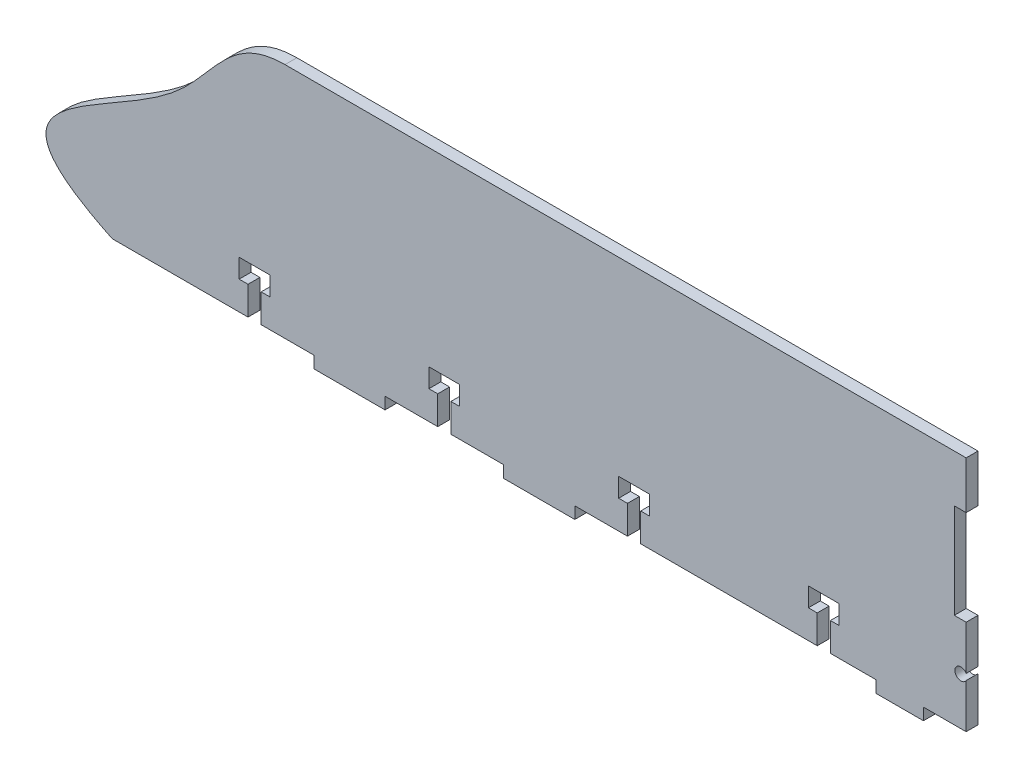
from build123d import *

# Parameters (mm, degrees)
BOSS_EXTRUDE1_DEPTH = 3.175


with BuildPart() as part:
    # Sketch1 → Boss-Extrude1 (new body)
    with BuildSketch(Plane.XY):
        with BuildLine():
            Line((-68.050090825, 31.75), (111.125, 31.75))
            Line((111.125, 31.75), (114.3, 31.75))
            Line((114.3, 31.75), (114.3, 19.05))
            Line((114.3, 19.05), (111.125, 19.05))
            Line((111.125, 19.05), (111.125, -6.35))
            Line((111.125, -6.35), (114.3, -6.35))
            Line((114.3, -6.35), (114.3, -18.229405084))
            ThreePointArc((114.3, -18.229405084), (111.271118366, -19.05), (114.3, -19.870594916))
            Line((114.3, -19.870594916), (114.3, -31.75))
            Line((114.3, -31.75), (111.125, -31.75))
            Line((111.125, -31.75), (102.87, -31.75))
            Line((102.87, -31.75), (102.87, -34.925))
            Line((102.87, -34.925), (90.17, -34.925))
            Line((90.17, -34.925), (90.17, -31.75))
            Line((90.17, -31.75), (88.19515, -31.75))
            Line((88.19515, -31.75), (77.9653, -31.75))
            Line((77.9653, -31.75), (77.9653, -24.13))
            Line((77.9653, -24.13), (80.3275, -24.13))
            Line((80.3275, -24.13), (80.3275, -19.05))
            Line((80.3275, -19.05), (72.0725, -19.05))
            Line((72.0725, -19.05), (72.0725, -24.13))
            Line((72.0725, -24.13), (74.4347, -24.13))
            Line((74.4347, -24.13), (74.4347, -31.75))
            Line((74.4347, -31.75), (27.1653, -31.75))
            Line((27.1653, -31.75), (27.1653, -24.13))
            Line((27.1653, -24.13), (29.5275, -24.13))
            Line((29.5275, -24.13), (29.5275, -19.05))
            Line((29.5275, -19.05), (21.2725, -19.05))
            Line((21.2725, -19.05), (21.2725, -24.13))
            Line((21.2725, -24.13), (23.6347, -24.13))
            Line((23.6347, -24.13), (23.6347, -31.75))
            Line((23.6347, -31.75), (9.525, -31.75))
            Line((9.525, -31.75), (9.525, -34.925))
            Line((9.525, -34.925), (-9.525, -34.925))
            Line((-9.525, -34.925), (-9.525, -31.75))
            Line((-9.525, -31.75), (-23.6347, -31.75))
            Line((-23.6347, -31.75), (-23.6347, -24.13))
            Line((-23.6347, -24.13), (-21.2725, -24.13))
            Line((-21.2725, -24.13), (-21.2725, -19.05))
            Line((-21.2725, -19.05), (-29.5275, -19.05))
            Line((-29.5275, -19.05), (-29.5275, -24.13))
            Line((-29.5275, -24.13), (-27.1653, -24.13))
            Line((-27.1653, -24.13), (-27.1653, -31.75))
            Line((-27.1653, -31.75), (-41.275, -31.75))
            Line((-41.275, -31.75), (-41.275, -34.925))
            Line((-41.275, -34.925), (-60.325, -34.925))
            Line((-60.325, -34.925), (-60.325, -31.75))
            Line((-60.325, -31.75), (-74.4347, -31.75))
            Line((-74.4347, -31.75), (-74.4347, -24.13))
            Line((-74.4347, -24.13), (-72.0725, -24.13))
            Line((-72.0725, -24.13), (-72.0725, -19.05))
            Line((-72.0725, -19.05), (-80.3275, -19.05))
            Line((-80.3275, -19.05), (-80.3275, -24.13))
            Line((-80.3275, -24.13), (-77.9653, -24.13))
            Line((-77.9653, -24.13), (-77.9653, -31.75))
            Line((-77.9653, -31.75), (-114.3, -31.75))
            add(Edge.make_bspline(
                [(-114.3, -31.75), (-155.042938789, -12.240400658), (-94.548851624, -1.377525337), (-82.535055103, 31.754341042), (-68.050090825, 31.75)],
                knots=[0, 0, 0, 0, 0.655069171, 1, 1, 1, 1], degree=3))
        make_face()
    extrude(amount=BOSS_EXTRUDE1_DEPTH)


solid = part.part
